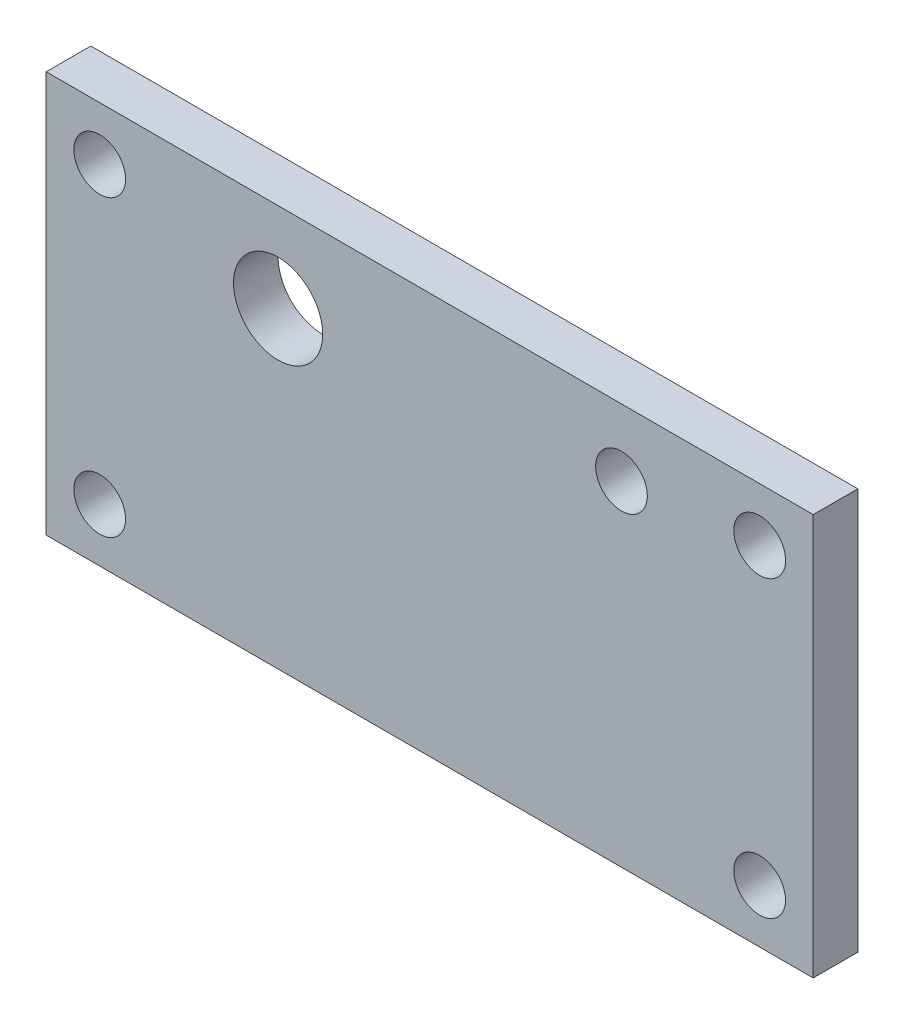
from build123d import *

# Parameters (mm, degrees)
SKETCH1_W           = 54.61
SKETCH1_H           = 28.575
SKETCH1_R           = 3.175
BOSS_EXTRUDE1_DEPTH = 3.175
SKETCH2_R           = 1.8415
CUT_EXTRUDE1_DEPTH  = 31.980256717
SKETCH4_R           = 1.8415
CUT_EXTRUDE2_DEPTH  = 31.980256717


with BuildPart() as part:
    # Sketch1 → Boss-Extrude1 (new body)
    with BuildSketch(Plane.XY):
        Rectangle(SKETCH1_W, SKETCH1_H)
        with Locations((-10.795, 7.9375)):
            Circle(SKETCH1_R, mode=Mode.SUBTRACT)
    extrude(amount=BOSS_EXTRUDE1_DEPTH)

    # Sketch2 → Cut-Extrude1 (cut, through all)
    with BuildSketch(Plane.XY.offset(3.175)):
        with Locations((-23.495, 10.4775)):
            Circle(SKETCH2_R)
        with Locations((-23.495, -10.4775)):
            Circle(SKETCH2_R)
        with Locations((23.495, -10.4775)):
            Circle(SKETCH2_R)
        with Locations((23.495, 10.4775)):
            Circle(SKETCH2_R)
    extrude(amount=-CUT_EXTRUDE1_DEPTH, mode=Mode.SUBTRACT)

    # Sketch4 → Cut-Extrude2 (cut, through all)
    with BuildSketch(Plane.XY.offset(3.175)):
        with Locations((13.6525, 9.525)):
            Circle(SKETCH4_R)
    extrude(amount=-CUT_EXTRUDE2_DEPTH, mode=Mode.SUBTRACT)


solid = part.part
